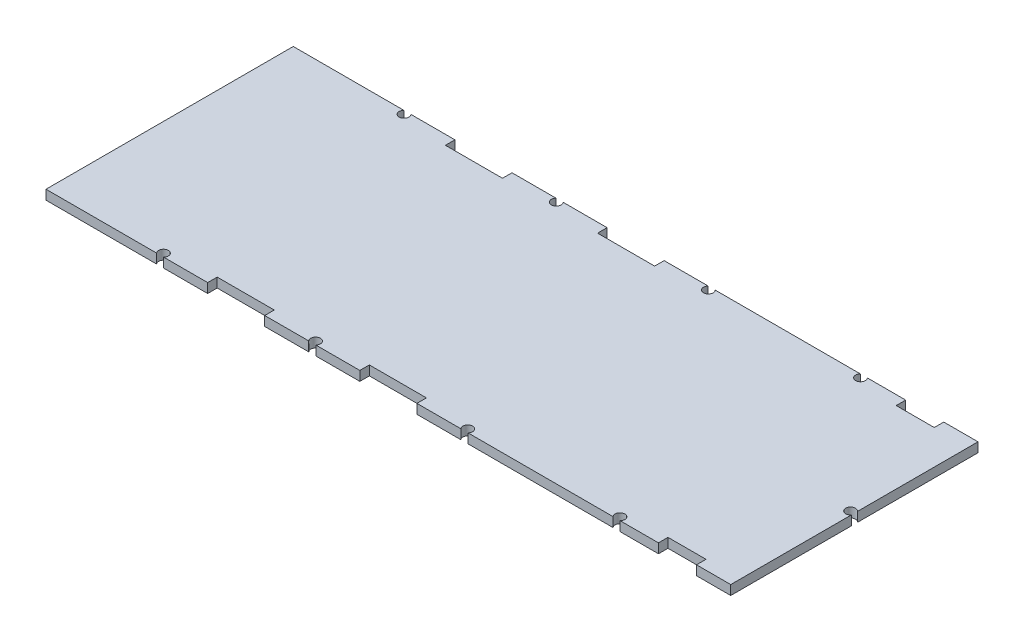
from build123d import *

# Parameters (mm, degrees)
BOSS_EXTRUDE1_DEPTH = 3.175


with BuildPart() as part:
    # Sketch1 → Boss-Extrude1 (new body)
    with BuildSketch(Plane(origin=(0, 0, 0), x_dir=(1, 0, 0), z_dir=(0, 1, 0))):
        with BuildLine():
            Line((114.3, -1.00715209), (114.3, -41.275))
            Line((114.3, -41.275), (102.87, -41.275))
            Line((102.87, -41.275), (102.87, -38.1))
            Line((102.87, -38.1), (90.17, -38.1))
            Line((90.17, -38.1), (90.17, -41.275))
            Line((90.17, -41.275), (89.493211941, -41.275))
            Line((89.493211941, -41.275), (77.386423882, -41.275))
            ThreePointArc((77.386423882, -41.275), (76.2, -38.53810628), (75.013576118, -41.275))
            Line((75.013576118, -41.275), (26.586423882, -41.275))
            ThreePointArc((26.586423882, -41.275), (25.4, -38.53810628), (24.213576118, -41.275))
            Line((24.213576118, -41.275), (9.525, -41.275))
            Line((9.525, -41.275), (9.525, -38.1))
            Line((9.525, -38.1), (-9.525, -38.1))
            Line((-9.525, -38.1), (-9.525, -41.275))
            Line((-9.525, -41.275), (-24.213576118, -41.275))
            ThreePointArc((-24.213576118, -41.275), (-25.4, -38.53810628), (-26.586423882, -41.275))
            Line((-26.586423882, -41.275), (-41.275, -41.275))
            Line((-41.275, -41.275), (-41.275, -38.1))
            Line((-41.275, -38.1), (-60.325, -38.1))
            Line((-60.325, -38.1), (-60.325, -41.275))
            Line((-60.325, -41.275), (-75.013576118, -41.275))
            ThreePointArc((-75.013576118, -41.275), (-76.2, -38.53810628), (-77.386423882, -41.275))
            Line((-77.386423882, -41.275), (-114.3, -41.275))
            Line((-114.3, -41.275), (-114.3, 41.275))
            Line((-114.3, 41.275), (-77.386423882, 41.275))
            ThreePointArc((-77.386423882, 41.275), (-76.2, 38.53810628), (-75.013576118, 41.275))
            Line((-75.013576118, 41.275), (-60.325, 41.275))
            Line((-60.325, 41.275), (-60.325, 38.1))
            Line((-60.325, 38.1), (-41.275, 38.1))
            Line((-41.275, 38.1), (-41.275, 41.275))
            Line((-41.275, 41.275), (-26.586423882, 41.275))
            ThreePointArc((-26.586423882, 41.275), (-25.4, 38.53810628), (-24.213576118, 41.275))
            Line((-24.213576118, 41.275), (-9.525, 41.275))
            Line((-9.525, 41.275), (-9.525, 38.1))
            Line((-9.525, 38.1), (9.525, 38.1))
            Line((9.525, 38.1), (9.525, 41.275))
            Line((9.525, 41.275), (24.213576118, 41.275))
            ThreePointArc((24.213576118, 41.275), (25.4, 38.53810628), (26.586423882, 41.275))
            Line((26.586423882, 41.275), (75.013576118, 41.275))
            ThreePointArc((75.013576118, 41.275), (76.2, 38.53810628), (77.386423882, 41.275))
            Line((77.386423882, 41.275), (89.493211941, 41.275))
            Line((89.493211941, 41.275), (90.17, 41.275))
            Line((90.17, 41.275), (90.17, 38.1))
            Line((90.17, 38.1), (102.87, 38.1))
            Line((102.87, 38.1), (102.87, 41.275))
            Line((102.87, 41.275), (114.3, 41.275))
            Line((114.3, 41.275), (114.3, 1.00715209))
            ThreePointArc((114.3, 1.00715209), (111.398382748, 0), (114.3, -1.00715209))
        make_face()
    extrude(amount=BOSS_EXTRUDE1_DEPTH)


solid = part.part
